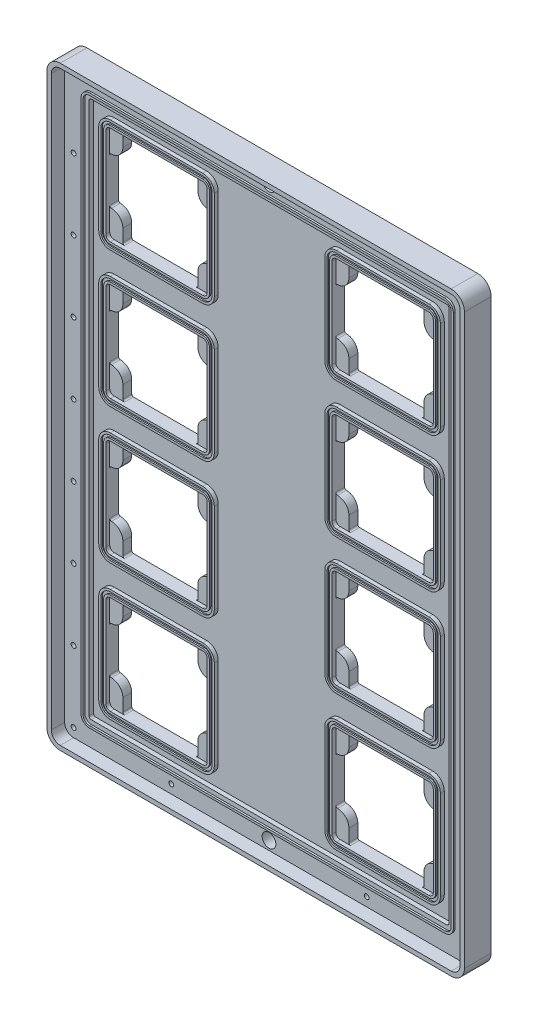
from build123d import *

# Parameters (mm, degrees)
SKETCH1_W            = 292.1
SKETCH1_H            = 419.1
BOSS_EXTRUDE1_DEPTH  = 9.525
SKETCH4_R            = 1.7272
CUT_EXTRUDE1_DEPTH   = 6.985
LPATTERN2_COUNT      = 8
LPATTERN2_PITCH      = 50.8
LPATTERN3_COUNT      = 4
LPATTERN3_PITCH      = 69.85
CUT_EXTRUDE3_DEPTH   = 3.175
BOSS_EXTRUDE2_DEPTH  = 1.3335
SKETCH7_R            = 4.9022
CUT_EXTRUDE4_DEPTH   = 511.938299235
FILLET1_R            = 6.35
CUT_EXTRUDE5_DEPTH   = 3.175
CUT_EXTRUDE6_DEPTH   = 511.964898033
SKETCH11_R           = 1.1303
CUT_EXTRUDE7_DEPTH   = 3.96875
BOSS_EXTRUDE3_DEPTH  = 2.794
BOSS_EXTRUDE4_DEPTH  = 1.778
LPATTERN1_COUNT      = 2
LPATTERN1_PITCH      = 161.5948
LPATTERN1_COUNT_DIR2 = 4
LPATTERN1_PITCH_DIR2 = 96.8756
BOSS_EXTRUDE5_START  = -19.05
BOSS_EXTRUDE5_DEPTH  = 19.05


with BuildPart() as part:
    # Sketch1 → Boss-Extrude1 (new body)
    with BuildSketch(Plane.XY):
        with Locations((146.05, 209.55)):
            Rectangle(SKETCH1_W, SKETCH1_H)
    extrude(amount=BOSS_EXTRUDE1_DEPTH)

    # Sketch4 → Cut-Extrude1 (cut)
    with BuildSketch(Plane.XY.offset(9.525)):
        with Locations((6.35, 6.35)):
            Circle(SKETCH4_R)
        with Locations((6.35, 412.75)):
            Circle(SKETCH4_R)
        with Locations((285.75, 412.75)):
            Circle(SKETCH4_R)
        with Locations((285.75, 6.35)):
            Circle(SKETCH4_R)
    cut_extrude1 = extrude(amount=-CUT_EXTRUDE1_DEPTH, mode=Mode.SUBTRACT)

    # LPattern2: Cut-Extrude1 ×8
    with Locations(*[(0, -i * LPATTERN2_PITCH, 0) for i in range(1, LPATTERN2_COUNT)]):
        add(cut_extrude1, mode=Mode.SUBTRACT)

    # LPattern3: Cut-Extrude1 ×4
    with Locations(*[(-i * LPATTERN3_PITCH, 0, 0) for i in range(1, LPATTERN3_COUNT)]):
        add(cut_extrude1, mode=Mode.SUBTRACT)

    # Sketch6 → Cut-Extrude3 (cut)
    with BuildSketch(Plane.XY.offset(9.525)):
        with BuildLine():
            Line((273.05, 401.6375), (19.05, 401.6375))
            ThreePointArc((19.05, 401.6375), (17.927467985, 401.172532015), (17.4625, 400.05))
            Line((17.4625, 400.05), (17.4625, 19.05))
            ThreePointArc((17.4625, 19.05), (17.927467985, 17.927467985), (19.05, 17.4625))
            Line((19.05, 17.4625), (273.05, 17.4625))
            ThreePointArc((273.05, 17.4625), (274.172532015, 17.927467985), (274.6375, 19.05))
            Line((274.6375, 19.05), (274.6375, 400.05))
            ThreePointArc((274.6375, 400.05), (274.172532015, 401.172532015), (273.05, 401.6375))
        make_face()
    extrude(amount=-CUT_EXTRUDE3_DEPTH, mode=Mode.SUBTRACT)

    # Sketch5 → Boss-Extrude2 (add)
    with BuildSketch(Plane.XY.offset(9.525)):
        with BuildLine():
            ThreePointArc((19.05, 406.146), (14.739477062, 404.360522938), (12.954, 400.05))
            Line((12.954, 400.05), (12.954, 19.05))
            ThreePointArc((12.954, 19.05), (14.739477062, 14.739477062), (19.05, 12.954))
            Line((19.05, 12.954), (273.05, 12.954))
            ThreePointArc((273.05, 12.954), (277.360522938, 14.739477062), (279.146, 19.05))
            Line((279.146, 19.05), (279.146, 400.05))
            ThreePointArc((279.146, 400.05), (277.360522938, 404.360522938), (273.05, 406.146))
            Line((273.05, 406.146), (19.05, 406.146))
        make_face()
        with BuildLine():
            ThreePointArc((273.05, 404.622), (276.282892204, 403.282892204), (277.622, 400.05))
            Line((277.622, 400.05), (277.622, 19.05))
            ThreePointArc((277.622, 19.05), (276.282892204, 15.817107796), (273.05, 14.478))
            Line((273.05, 14.478), (19.05, 14.478))
            ThreePointArc((19.05, 14.478), (15.817107796, 15.817107796), (14.478, 19.05))
            Line((14.478, 19.05), (14.478, 400.05))
            ThreePointArc((14.478, 400.05), (15.817107796, 403.282892204), (19.05, 404.622))
            Line((19.05, 404.622), (273.05, 404.622))
        make_face(mode=Mode.SUBTRACT)
    extrude(amount=BOSS_EXTRUDE2_DEPTH)

    # Sketch7 → Cut-Extrude4 (cut, through all)
    with BuildSketch(Plane.XY.offset(9.525)):
        with Locations((146.05, 6.35)):
            Circle(SKETCH7_R)
        with Locations((146.05, 412.75)):
            Circle(SKETCH7_R)
    extrude(amount=-CUT_EXTRUDE4_DEPTH, mode=Mode.SUBTRACT)

    # Fillet1
    fillet1_edges = [part.edges().sort_by_distance(p)[0] for p in [
        (0, 419.1, 4.7625),
        (292.1, 419.1, 4.7625),
        (0, 0, 4.7625),
        (292.1, 0, 4.7625),
    ]]
    fillet(fillet1_edges, radius=FILLET1_R)

    # Sketch8 → Cut-Extrude5 (cut)
    with BuildSketch(Plane(origin=(0, 0, 0), x_dir=(-1, 0, 0), z_dir=(0, 0, -1))):
        with BuildLine():
            Line((-201.2442, 393.7), (-252.4506, 393.7))
            ThreePointArc((-252.4506, 393.7), (-255.881057838, 392.279057838), (-257.302, 388.8486))
            Line((-257.302, 388.8486), (-257.302, 379.857))
            ThreePointArc((-257.302, 379.857), (-258.633668309, 376.642068309), (-261.8486, 375.3104))
            ThreePointArc((-261.8486, 375.3104), (-265.279057838, 373.889457838), (-266.7, 370.459))
            Line((-266.7, 370.459), (-266.7, 339.2678))
            ThreePointArc((-266.7, 339.2678), (-265.279057838, 335.837342162), (-261.8486, 334.4164))
            ThreePointArc((-261.8486, 334.4164), (-258.633668309, 333.084731691), (-257.302, 329.8698))
            Line((-257.302, 329.8698), (-257.302, 320.8782))
            ThreePointArc((-257.302, 320.8782), (-255.881057838, 317.447742162), (-252.4506, 316.0268))
            Line((-252.4506, 316.0268), (-201.2442, 316.0268))
            ThreePointArc((-201.2442, 316.0268), (-197.813742162, 317.447742162), (-196.3928, 320.8782))
            Line((-196.3928, 320.8782), (-196.3928, 329.8698))
            ThreePointArc((-196.3928, 329.8698), (-195.061131691, 333.084731691), (-191.8462, 334.4164))
            ThreePointArc((-191.8462, 334.4164), (-188.415742162, 335.837342162), (-186.9948, 339.2678))
            Line((-186.9948, 339.2678), (-186.9948, 370.459))
            ThreePointArc((-186.9948, 370.459), (-188.415742162, 373.889457838), (-191.8462, 375.3104))
            ThreePointArc((-191.8462, 375.3104), (-195.061131691, 376.642068309), (-196.3928, 379.857))
            Line((-196.3928, 379.857), (-196.3928, 388.8486))
            ThreePointArc((-196.3928, 388.8486), (-197.813742162, 392.279057838), (-201.2442, 393.7))
        make_face()
        with BuildLine():
            Line((-264.668, 370.459), (-264.668, 339.2678))
            ThreePointArc((-264.668, 339.2678), (-263.842216859, 337.274183141), (-261.8486, 336.4484))
            ThreePointArc((-261.8486, 336.4484), (-257.196827329, 334.521572671), (-255.27, 329.8698))
            Line((-255.27, 329.8698), (-255.27, 320.8782))
            ThreePointArc((-255.27, 320.8782), (-254.444216859, 318.884583141), (-252.4506, 318.0588))
            Line((-252.4506, 318.0588), (-201.2442, 318.0588))
            ThreePointArc((-201.2442, 318.0588), (-199.250583141, 318.884583141), (-198.4248, 320.8782))
            Line((-198.4248, 320.8782), (-198.4248, 329.8698))
            ThreePointArc((-198.4248, 329.8698), (-196.497972671, 334.521572671), (-191.8462, 336.4484))
            ThreePointArc((-191.8462, 336.4484), (-189.852583141, 337.274183141), (-189.0268, 339.2678))
            Line((-189.0268, 339.2678), (-189.0268, 370.459))
            ThreePointArc((-189.0268, 370.459), (-189.852583141, 372.452616859), (-191.8462, 373.2784))
            ThreePointArc((-191.8462, 373.2784), (-196.497972671, 375.205227329), (-198.4248, 379.857))
            Line((-198.4248, 379.857), (-198.4248, 388.8486))
            ThreePointArc((-198.4248, 388.8486), (-199.250583141, 390.842216859), (-201.2442, 391.668))
            Line((-201.2442, 391.668), (-252.4506, 391.668))
            ThreePointArc((-252.4506, 391.668), (-254.444216859, 390.842216859), (-255.27, 388.8486))
            Line((-255.27, 388.8486), (-255.27, 379.857))
            ThreePointArc((-255.27, 379.857), (-257.196827329, 375.205227329), (-261.8486, 373.2784))
            ThreePointArc((-261.8486, 373.2784), (-263.842216859, 372.452616859), (-264.668, 370.459))
        make_face(mode=Mode.SUBTRACT)
    cut_extrude5 = extrude(amount=-CUT_EXTRUDE5_DEPTH, mode=Mode.SUBTRACT)

    # Sketch10 → Cut-Extrude6 (cut, through all)
    with BuildSketch(Plane(origin=(0, 0, 0), x_dir=(-1, 0, 0), z_dir=(0, 0, -1))):
        with BuildLine():
            Line((-263.0805, 370.459), (-263.0805, 339.2678))
            ThreePointArc((-263.0805, 339.2678), (-262.719684844, 338.396715156), (-261.8486, 338.0359))
            ThreePointArc((-261.8486, 338.0359), (-256.074295314, 335.644104686), (-253.6825, 329.8698))
            Line((-253.6825, 329.8698), (-253.6825, 320.8782))
            ThreePointArc((-253.6825, 320.8782), (-253.321684844, 320.007115156), (-252.4506, 319.6463))
            Line((-252.4506, 319.6463), (-201.2442, 319.6463))
            ThreePointArc((-201.2442, 319.6463), (-200.373115156, 320.007115156), (-200.0123, 320.8782))
            Line((-200.0123, 320.8782), (-200.0123, 329.8698))
            ThreePointArc((-200.0123, 329.8698), (-197.620504686, 335.644104686), (-191.8462, 338.0359))
            ThreePointArc((-191.8462, 338.0359), (-190.975115156, 338.396715156), (-190.6143, 339.2678))
            Line((-190.6143, 339.2678), (-190.6143, 370.459))
            ThreePointArc((-190.6143, 370.459), (-190.975115156, 371.330084844), (-191.8462, 371.6909))
            ThreePointArc((-191.8462, 371.6909), (-197.620504686, 374.082695314), (-200.0123, 379.857))
            Line((-200.0123, 379.857), (-200.0123, 388.8486))
            ThreePointArc((-200.0123, 388.8486), (-200.373115156, 389.719684844), (-201.2442, 390.0805))
            Line((-201.2442, 390.0805), (-252.4506, 390.0805))
            ThreePointArc((-252.4506, 390.0805), (-253.321684844, 389.719684844), (-253.6825, 388.8486))
            Line((-253.6825, 388.8486), (-253.6825, 379.857))
            ThreePointArc((-253.6825, 379.857), (-256.074295314, 374.082695314), (-261.8486, 371.6909))
            ThreePointArc((-261.8486, 371.6909), (-262.719684844, 371.330084844), (-263.0805, 370.459))
        make_face()
    cut_extrude6 = extrude(amount=-CUT_EXTRUDE6_DEPTH, mode=Mode.SUBTRACT)

    # Sketch11 → Cut-Extrude7 (cut)
    with BuildSketch(Plane(origin=(0, 0, 0), x_dir=(-1, 0, 0), z_dir=(0, 0, -1))):
        with Locations((-261.8486, 388.8994)):
            Circle(SKETCH11_R)
        with Locations((-191.8462, 388.8994)):
            Circle(SKETCH11_R)
        with Locations((-191.8462, 320.8274)):
            Circle(SKETCH11_R)
        with Locations((-261.8486, 320.8274)):
            Circle(SKETCH11_R)
    cut_extrude7 = extrude(amount=-CUT_EXTRUDE7_DEPTH, mode=Mode.SUBTRACT)

    # Sketch12 → Boss-Extrude3 (add)
    # profile 1 of 2: a face of its own
    with BuildSketch(Plane.XY.offset(6.35)):
        with BuildLine():
            ThreePointArc((193.7893, 395.1605), (187.952133521, 392.742666479), (185.5343, 386.9055))
            Line((185.5343, 386.9055), (185.5343, 322.8213))
            ThreePointArc((185.5343, 322.8213), (187.952133521, 316.984133521), (193.7893, 314.5663))
            Line((193.7893, 314.5663), (259.9055, 314.5663))
            ThreePointArc((259.9055, 314.5663), (265.742666479, 316.984133521), (268.1605, 322.8213))
            Line((268.1605, 322.8213), (268.1605, 386.9055))
            ThreePointArc((268.1605, 386.9055), (265.742666479, 392.742666479), (259.9055, 395.1605))
            Line((259.9055, 395.1605), (193.7893, 395.1605))
        make_face()
        with BuildLine():
            Line((187.1218, 322.8213), (187.1218, 386.9055))
            ThreePointArc((187.1218, 386.9055), (189.074665536, 391.620134464), (193.7893, 393.573))
            Line((193.7893, 393.573), (259.9055, 393.573))
            ThreePointArc((259.9055, 393.573), (264.620134464, 391.620134464), (266.573, 386.9055))
            Line((266.573, 386.9055), (266.573, 322.8213))
            ThreePointArc((266.573, 322.8213), (264.620134464, 318.106665536), (259.9055, 316.1538))
            Line((259.9055, 316.1538), (193.7893, 316.1538))
            ThreePointArc((193.7893, 316.1538), (189.074665536, 318.106665536), (187.1218, 322.8213))
        make_face(mode=Mode.SUBTRACT)
    # profile 2 of 2: a face of its own
    with BuildSketch(Plane.XY.offset(6.35)):
        with BuildLine():
            Line((259.9055, 391.668), (193.7893, 391.668))
            ThreePointArc((193.7893, 391.668), (190.421703955, 390.273096045), (189.0268, 386.9055))
            Line((189.0268, 386.9055), (189.0268, 322.8213))
            ThreePointArc((189.0268, 322.8213), (190.421703955, 319.453703955), (193.7893, 318.0588))
            Line((193.7893, 318.0588), (259.9055, 318.0588))
            ThreePointArc((259.9055, 318.0588), (263.273096045, 319.453703955), (264.668, 322.8213))
            Line((264.668, 322.8213), (264.668, 386.9055))
            ThreePointArc((264.668, 386.9055), (263.273096045, 390.273096045), (259.9055, 391.668))
        make_face()
        with BuildLine():
            ThreePointArc((190.6143, 386.9055), (191.54423597, 389.15056403), (193.7893, 390.0805))
            Line((193.7893, 390.0805), (259.9055, 390.0805))
            ThreePointArc((259.9055, 390.0805), (262.15056403, 389.15056403), (263.0805, 386.9055))
            Line((263.0805, 386.9055), (263.0805, 322.8213))
            ThreePointArc((263.0805, 322.8213), (262.15056403, 320.57623597), (259.9055, 319.6463))
            Line((259.9055, 319.6463), (193.7893, 319.6463))
            ThreePointArc((193.7893, 319.6463), (191.54423597, 320.57623597), (190.6143, 322.8213))
            Line((190.6143, 322.8213), (190.6143, 386.9055))
        make_face(mode=Mode.SUBTRACT)
    boss_extrude3 = extrude(amount=BOSS_EXTRUDE3_DEPTH)

    # Sketch12<3> → Boss-Extrude4 (add)
    with BuildSketch(Plane.XY.offset(6.35)):
        with BuildLine():
            ThreePointArc((193.7893, 393.573), (189.074665536, 391.620134464), (187.1218, 386.9055))
            Line((187.1218, 386.9055), (187.1218, 322.8213))
            ThreePointArc((187.1218, 322.8213), (189.074665536, 318.106665536), (193.7893, 316.1538))
            Line((193.7893, 316.1538), (259.9055, 316.1538))
            ThreePointArc((259.9055, 316.1538), (264.620134464, 318.106665536), (266.573, 322.8213))
            Line((266.573, 322.8213), (266.573, 386.9055))
            ThreePointArc((266.573, 386.9055), (264.620134464, 391.620134464), (259.9055, 393.573))
            Line((259.9055, 393.573), (193.7893, 393.573))
        make_face()
        with BuildLine():
            ThreePointArc((189.0268, 386.9055), (190.421703955, 390.273096045), (193.7893, 391.668))
            Line((193.7893, 391.668), (259.9055, 391.668))
            ThreePointArc((259.9055, 391.668), (263.273096045, 390.273096045), (264.668, 386.9055))
            Line((264.668, 386.9055), (264.668, 322.8213))
            ThreePointArc((264.668, 322.8213), (263.273096045, 319.453703955), (259.9055, 318.0588))
            Line((259.9055, 318.0588), (193.7893, 318.0588))
            ThreePointArc((193.7893, 318.0588), (190.421703955, 319.453703955), (189.0268, 322.8213))
            Line((189.0268, 322.8213), (189.0268, 386.9055))
        make_face(mode=Mode.SUBTRACT)
    boss_extrude4 = extrude(amount=BOSS_EXTRUDE4_DEPTH)

    # LPattern1: Cut-Extrude5, Cut-Extrude6, Cut-Extrude7, Boss-Extrude3, Boss-Extrude4 2 × 4
    with Locations(*[(-i * LPATTERN1_PITCH, -j * LPATTERN1_PITCH_DIR2, 0) for i in range(LPATTERN1_COUNT) for j in range(LPATTERN1_COUNT_DIR2) if (i, j) != (0, 0)]):
        add(cut_extrude5, mode=Mode.SUBTRACT)
        add(cut_extrude6, mode=Mode.SUBTRACT)
        add(cut_extrude7, mode=Mode.SUBTRACT)
        add(boss_extrude3)
        add(boss_extrude4)

    # Sketch13 → Boss-Extrude5 (add)
    with BuildSketch(Plane(origin=(0, 0, 0), x_dir=(-1, 0, 0), z_dir=(0, 0, -1)).offset(BOSS_EXTRUDE5_START)):
        with BuildLine():
            Line((-285.75, -3.175), (-6.35, -3.175))
            ThreePointArc((-6.35, -3.175), (0.385192091, -0.385192091), (3.175, 6.35))
            Line((3.175, 6.35), (3.175, 412.75))
            ThreePointArc((3.175, 412.75), (0.385192091, 419.485192091), (-6.35, 422.275))
            Line((-6.35, 422.275), (-285.75, 422.275))
            ThreePointArc((-285.75, 422.275), (-292.485192091, 419.485192091), (-295.275, 412.75))
            Line((-295.275, 412.75), (-295.275, 6.35))
            ThreePointArc((-295.275, 6.35), (-292.485192091, -0.385192091), (-285.75, -3.175))
        make_face()
        with BuildLine():
            Line((-6.35, 419.1), (-285.75, 419.1))
            ThreePointArc((-285.75, 419.1), (-290.240128061, 417.240128061), (-292.1, 412.75))
            Line((-292.1, 412.75), (-292.1, 6.35))
            ThreePointArc((-292.1, 6.35), (-290.240128061, 1.859871939), (-285.75, 0))
            Line((-285.75, 0), (-6.35, 0))
            ThreePointArc((-6.35, 0), (-1.859871939, 1.859871939), (0, 6.35))
            Line((0, 6.35), (0, 412.75))
            ThreePointArc((0, 412.75), (-1.859871939, 417.240128061), (-6.35, 419.1))
        make_face(mode=Mode.SUBTRACT)
    extrude(amount=BOSS_EXTRUDE5_DEPTH)


solid = part.part
